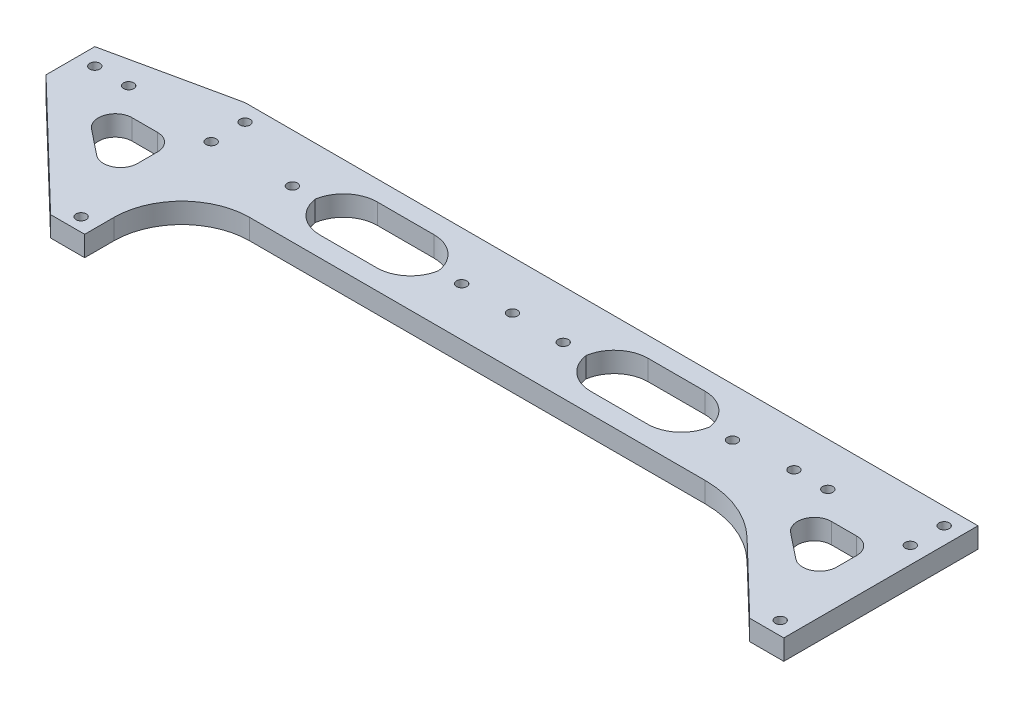
from build123d import *

# Parameters (mm, degrees)
SKETCH1_R           = 1.5
BOSS_EXTRUDE1_DEPTH = 3
SKETCH4_R           = 1.5
CUT_EXTRUDE2_DEPTH  = 7
SKETCH5_W           = 46.5
SKETCH5_H           = 2
CUT_EXTRUDE3_DEPTH  = 7
CUT_EXTRUDE4_DEPTH  = 7
CUT_EXTRUDE5_DEPTH  = 7
BOSS_EXTRUDE2_START = -6
SKETCH8_R           = 1.5
BOSS_EXTRUDE2_DEPTH = 6
SKETCH9_R           = 1.5
CUT_EXTRUDE6_DEPTH  = 6
SKETCH10_R          = 1.5
CUT_EXTRUDE7_DEPTH  = 6
SKETCH11_W          = 36.769244088
SKETCH11_H          = 16.925373541
CUT_EXTRUDE8_DEPTH  = 14
FILLET2_R           = 5
FILLET3_R           = 10
FILLET4_R           = 20
FILLET5_R           = 30
FILLET6_R           = 10


with BuildPart() as part:
    # Sketch1 → Boss-Extrude1 (new body)
    # profile 1 of 4: a face of its own
    with BuildSketch(Plane(origin=(0, 0, 0), x_dir=(1, 0, 0), z_dir=(0, 1, 0))):
        Polygon((5, 16.666723622), (5, 56.73), (-5, 56.73), (-5, 5.234024539), (5, 5.234024539), (31.5, 5.234024539), (41.5, 5.234024539), (41.5, 64.6), (31.5, 64.6), (31.5, 54.48), (31.5, 16.666723622), align=None)
        with Locations(Location((0, 10.18, 0), (0, 0, 270))):
            Circle(SKETCH1_R, mode=Mode.SUBTRACT)
        with Locations(Location((36.5, 11.18, 0), (0, 0, 270))):
            Circle(SKETCH1_R, mode=Mode.SUBTRACT)
        with Locations(Location((0, 51.73, 0), (0, 0, 270))):
            Circle(SKETCH1_R, mode=Mode.SUBTRACT)
        with Locations(Location((36.5, 49.6, 0), (0, 0, 270))):
            Circle(SKETCH1_R, mode=Mode.SUBTRACT)
        with Locations(Location((36.5, 59.6, 0), (0, 0, 270))):
            Circle(SKETCH1_R, mode=Mode.SUBTRACT)
    # profile 2 of 4: a face of its own
    with BuildSketch(Plane(origin=(0, 0, 0), x_dir=(1, 0, 0), z_dir=(0, 1, 0))):
        Polygon((-5, 56.73), (5, 56.73), (31.5, 54.48), (31.5, 64.6), align=None)
    # profile 3 of 4: a face of its own
    with BuildSketch(Plane(origin=(0, 0, 0), x_dir=(1, 0, 0), z_dir=(0, 1, 0))):
        Polygon((5, 16.666723622), (5, 56.73), (-5, 56.73), (-5, 5.234024539), (5, 5.234024539), (31.5, 5.234024539), (41.5, 5.234024539), (41.5, 64.6), (31.5, 64.6), (31.5, 54.48), (31.5, 16.666723622), align=None)
        with Locations(Location((0, 10.18, 0), (0, 0, 270))):
            Circle(SKETCH1_R, mode=Mode.SUBTRACT)
        with Locations(Location((36.5, 11.18, 0), (0, 0, 270))):
            Circle(SKETCH1_R, mode=Mode.SUBTRACT)
        with Locations(Location((0, 51.73, 0), (0, 0, 270))):
            Circle(SKETCH1_R, mode=Mode.SUBTRACT)
        with Locations(Location((36.5, 49.6, 0), (0, 0, 270))):
            Circle(SKETCH1_R, mode=Mode.SUBTRACT)
        with Locations(Location((36.5, 59.6, 0), (0, 0, 270))):
            Circle(SKETCH1_R, mode=Mode.SUBTRACT)
    # profile 4 of 4: a face of its own
    with BuildSketch(Plane(origin=(0, 0, 0), x_dir=(1, 0, 0), z_dir=(0, 1, 0))):
        Polygon((31.5, 54.48), (5, 56.73), (5, 16.666723622), (31.5, 16.666723622), align=None)
    extrude(amount=BOSS_EXTRUDE1_DEPTH)

    # Sketch4 → Cut-Extrude2 (cut)
    with BuildSketch(Plane(origin=(0, 3, 0), x_dir=(1, 0, 0), z_dir=(0, 1, 0))):
        with Locations(Location((10, 51.73, 0), (0, 0, 270))):
            Circle(SKETCH4_R)
    extrude(amount=-CUT_EXTRUDE2_DEPTH, mode=Mode.SUBTRACT)

    # Sketch5 → Cut-Extrude3 (cut)
    with BuildSketch(Plane(origin=(0, 3, 0), x_dir=(1, 0, 0), z_dir=(0, 1, 0))):
        with Locations((18.25, 6.234024539)):
            Rectangle(SKETCH5_W, SKETCH5_H)
    extrude(amount=-CUT_EXTRUDE3_DEPTH, mode=Mode.SUBTRACT)

    # Sketch6 → Cut-Extrude4 (cut)
    with BuildSketch(Plane(origin=(0, 3, 0), x_dir=(1, 0, 0), z_dir=(0, 1, 0))):
        Polygon((31.443621834, 7.234024539), (-5, 42.312799573), (-5, 7.234024539), align=None)
    extrude(amount=-CUT_EXTRUDE4_DEPTH, mode=Mode.SUBTRACT)

    # Sketch7 → Cut-Extrude5 (cut)
    with BuildSketch(Plane(origin=(0, 3, 0), x_dir=(1, 0, 0), z_dir=(0, 1, 0))):
        Polygon((31.193110027, 22.772878628), (31.193110027, 44.066382221), (4.388346681, 44.066382221), align=None)
    extrude(amount=-CUT_EXTRUDE5_DEPTH, mode=Mode.SUBTRACT)

    # Sketch8 → Boss-Extrude2 (add)
    # profile 1 of 3: a face of its own
    with BuildSketch(Plane(origin=(0, 3, 0), x_dir=(1, 0, 0), z_dir=(0, 1, 0)).offset(BOSS_EXTRUDE2_START)):
        Polygon((238, 64.6), (41.5, 64.6), (41.5, 35.917012269), (208.144634928, 35.917012269), (201.5, 42.312799573), (201.5, 56.73), align=None)
    # profile 2 of 3: a face of its own
    with BuildSketch(Plane(origin=(0, 3, 0), x_dir=(1, 0, 0), z_dir=(0, 1, 0)).offset(BOSS_EXTRUDE2_START)):
        Polygon((237.943621834, 7.234024539), (248, 7.234024539), (248, 64.6), (238, 64.6), (201.5, 56.73), (201.5, 42.312799573), align=None)
        with Locations(Location((243, 11.18, 0), (0, 0, 270))):
            Circle(SKETCH8_R, mode=Mode.SUBTRACT)
        with Locations(Location((243, 59.6, 0), (0, 0, 270))):
            Circle(SKETCH8_R, mode=Mode.SUBTRACT)
        with Locations(Location((243, 49.6, 0), (0, 0, 270))):
            Circle(SKETCH8_R, mode=Mode.SUBTRACT)
        with Locations(Location((216.5, 51.73, 0), (0, 0, 270))):
            Circle(SKETCH8_R, mode=Mode.SUBTRACT)
        with Locations(Location((206.5, 51.73, 0), (0, 0, 270))):
            Circle(SKETCH8_R, mode=Mode.SUBTRACT)
        Polygon((237.693110027, 44.066382221), (237.693110027, 22.772878628), (210.888346681, 44.066382221), align=None, mode=Mode.SUBTRACT)
    # profile 3 of 3: a face of its own
    with BuildSketch(Plane(origin=(0, 3, 0), x_dir=(1, 0, 0), z_dir=(0, 1, 0)).offset(BOSS_EXTRUDE2_START)):
        Polygon((41.5, 35.917012269), (41.5, 64.6), (31.5, 64.6), (-5, 56.73), (-5, 42.312799573), (31.443621834, 7.234024539), (41.5, 7.234024539), align=None)
        with Locations(Location((36.5, 11.18, 0), (0, 0, 270))):
            Circle(SKETCH8_R, mode=Mode.SUBTRACT)
        Polygon((31.193110027, 22.772878628), (4.388346681, 44.066382221), (31.193110027, 44.066382221), align=None, mode=Mode.SUBTRACT)
        with Locations(Location((36.5, 49.6, 0), (0, 0, 270))):
            Circle(SKETCH8_R, mode=Mode.SUBTRACT)
        with Locations(Location((0, 51.73, 0), (0, 0, 270))):
            Circle(SKETCH8_R, mode=Mode.SUBTRACT)
        with Locations(Location((10, 51.73, 0), (0, 0, 270))):
            Circle(SKETCH8_R, mode=Mode.SUBTRACT)
        with Locations(Location((36.5, 59.6, 0), (0, 0, 270))):
            Circle(SKETCH8_R, mode=Mode.SUBTRACT)
    extrude(amount=BOSS_EXTRUDE2_DEPTH)

    # Sketch9 → Cut-Extrude6 (cut)
    with BuildSketch(Plane(origin=(0, 3, 0), x_dir=(1, 0, 0), z_dir=(0, 1, 0))):
        with Locations(Location((59.822317464, 50.258506135, 0), (0, 0, 270))):
            Circle(SKETCH9_R)
        with Locations(Location((189.822317464, 50.258506135, 0), (0, 0, 90))):
            Circle(SKETCH9_R)
        with Locations(Location((124.822317464, 50.258506135, 0), (0, 0, 270))):
            Circle(SKETCH9_R)
    extrude(amount=-CUT_EXTRUDE6_DEPTH, mode=Mode.SUBTRACT)

    # Sketch10 → Cut-Extrude7 (cut)
    with BuildSketch(Plane(origin=(0, 3, 0), x_dir=(1, 0, 0), z_dir=(0, 1, 0))):
        with Locations(Location((124.822317464, 50.258506135, 0), (0, 0, 270))):
            Circle(SKETCH10_R)
        with Locations(Location((109.822317464, 50.258506135, 0), (0, 0, 270))):
            Circle(SKETCH10_R)
        with Locations(Location((139.822317464, 50.258506135, 0), (0, 0, 270))):
            Circle(SKETCH10_R)
    extrude(amount=-CUT_EXTRUDE7_DEPTH, mode=Mode.SUBTRACT)

    # Sketch11 → Cut-Extrude8 (cut)
    with BuildSketch(Plane(origin=(0, 3, 0), x_dir=(1, 0, 0), z_dir=(0, 1, 0))):
        with Locations((84.822317464, 50.258506135)):
            Rectangle(SKETCH11_W, SKETCH11_H)
        with Locations((164.822317464, 50.258506135)):
            Rectangle(SKETCH11_W, SKETCH11_H)
    extrude(amount=-CUT_EXTRUDE8_DEPTH, mode=Mode.SUBTRACT)

    # Fillet2
    fillet2_edges = [part.edges().sort_by_distance(p)[0] for p in [
        (237.693110027, 0, -22.772878628),
        (237.693110027, 0, -44.066382221),
        (210.888346681, 0, -44.066382221),
        (31.193110027, 0, -22.772878628),
        (4.388346681, 0, -44.066382221),
        (31.193110027, 0, -44.066382221),
    ]]
    fillet(fillet2_edges, radius=FILLET2_R)

    # Fillet3
    # the kernel refuses this fillet: 10 mm, written as the material it adds along each edge
    with BuildSketch(Plane(origin=(183.206939508, 3, -41.795819364), x_dir=(-1, 0, 0), z_dir=(0, -1, 0)), Plane(origin=(146.43769542, 3, -41.795819364), x_dir=(0, 0, -1), z_dir=(0, -1, 0)), Plane(origin=(146.43769542, 3, -58.721192905), x_dir=(1, 0, 0), z_dir=(0, -1, 0)), Plane(origin=(103.206939508, 3, -41.795819364), x_dir=(-1, 0, 0), z_dir=(0, -1, 0)), Plane(origin=(66.43769542, 3, -58.721192905), x_dir=(1, 0, 0), z_dir=(0, -1, 0)), Plane(origin=(103.206939508, 3, -58.721192905), x_dir=(0, 0, 1), z_dir=(0, -1, 0))) as fillet3_piece_1:
        with BuildLine():
            CenterArc((FILLET3_R, FILLET3_R), FILLET3_R, 180, 90)
            Line((0, FILLET3_R), (0, 0))
            Line((0, 0), (FILLET3_R, 0))
        make_face()
    extrude(amount=6)
    with BuildSketch(Plane(origin=(183.206939508, 3, -58.721192905), x_dir=(-1, 0, 0), z_dir=(0, -1, 0)), Plane(origin=(66.43769542, 3, -41.795819364), x_dir=(1, 0, 0), z_dir=(0, -1, 0))) as fillet3_piece_2:
        with BuildLine():
            CenterArc((FILLET3_R, -FILLET3_R), FILLET3_R, 90, 90)
            Line((0, -FILLET3_R), (0, 0))
            Line((0, 0), (FILLET3_R, 0))
        make_face()
    extrude(amount=6)

    # Fillet4
    fillet4_edges = [part.edges().sort_by_distance(p)[0] for p in [
        (41.5, 0, -35.917012269),
    ]]
    fillet(fillet4_edges, radius=FILLET4_R)

    # Fillet5
    fillet5_edges = [part.edges().sort_by_distance(p)[0] for p in [
        (208.144634928, 0, -35.917012269),
    ]]
    fillet(fillet5_edges, radius=FILLET5_R)

    # Fillet6
    fillet6_edges = [part.edges().sort_by_distance(p)[0] for p in [
        (31.5, 0, -64.6),
    ]]
    fillet(fillet6_edges, radius=FILLET6_R)


solid = part.part
